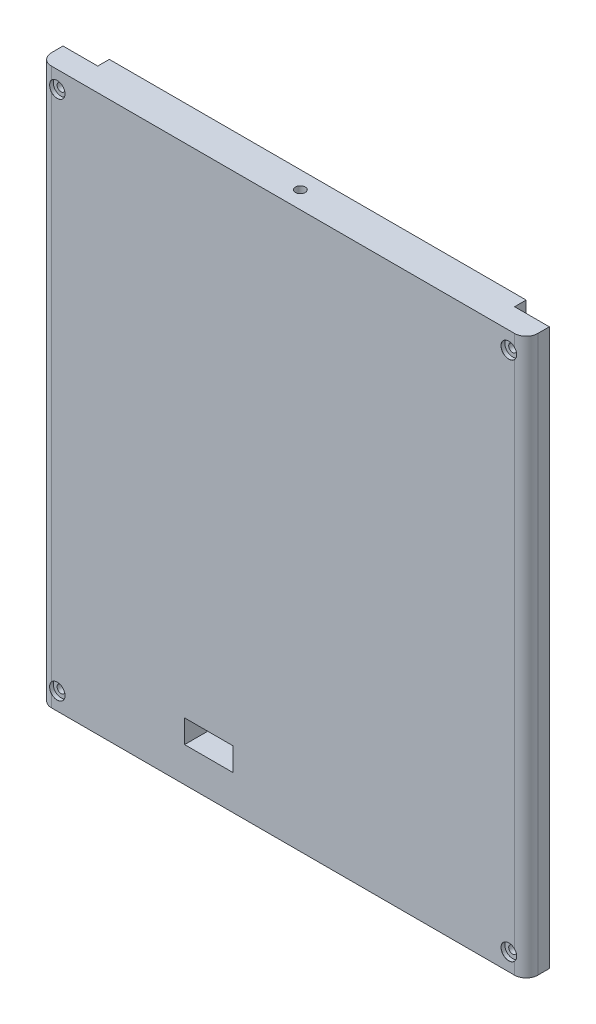
from build123d import *

# Parameters (mm, degrees)
SKETCH3_W           = 210
SKETCH3_H           = 10
BOSS_EXTRUDE1_DEPTH = 240
BOSS_EXTRUDE2_DEPTH = 205
SKETCH6_W           = 45
SKETCH6_H           = 15
BOSS_EXTRUDE3_DEPTH = 10
SKETCH7_R           = 1.65
CUT_EXTRUDE1_DEPTH  = 10
SKETCH8_W           = 21
SKETCH8_H           = 10
CUT_EXTRUDE2_DEPTH  = 10
SKETCH10_R          = 2.1
CUT_EXTRUDE3_DEPTH  = 4.5
FILLET2_R           = 5


with BuildPart() as part:
    # Sketch3 → Boss-Extrude1 (new body)
    with BuildSketch(Plane(origin=(0, 0, 0), x_dir=(1, 0, 0), z_dir=(0, 1, 0))):
        with Locations((0, -5)):
            Rectangle(SKETCH3_W, SKETCH3_H)
    extrude(amount=BOSS_EXTRUDE1_DEPTH)

    # Sketch5 → Boss-Extrude2 (add)
    with BuildSketch(Plane(origin=(0, 240, 0), x_dir=(1, 0, 0), z_dir=(0, 1, 0))):
        Polygon((-90, 0), (-90, 5), (90, 5), (90, 0), (105, 0), (105, -10), (-105, -10), (-105, 0), align=None)
    extrude(amount=-BOSS_EXTRUDE2_DEPTH)

    # Sketch6 → Boss-Extrude3 (add)
    with BuildSketch(Plane(origin=(0, 35, 0), x_dir=(1, 0, 0), z_dir=(0, 1, 0))):
        with Locations((0, 7.5)):
            Rectangle(SKETCH6_W, SKETCH6_H)
    extrude(amount=-BOSS_EXTRUDE3_DEPTH)

    # Sketch7 → Cut-Extrude1 (cut)
    with BuildSketch(Plane.XY.offset(10)):
        with Locations((-97.5, 232.5)):
            Circle(SKETCH7_R)
        with Locations((-97.5, 7.5)):
            Circle(SKETCH7_R)
        with Locations((97.5, 7.5)):
            Circle(SKETCH7_R)
        with Locations((97.5, 232.5)):
            Circle(SKETCH7_R)
    extrude(amount=-CUT_EXTRUDE1_DEPTH, mode=Mode.SUBTRACT)

    # Sketch8 → Cut-Extrude2 (cut)
    with BuildSketch(Plane.XY.offset(10)):
        with Locations((-32, 20)):
            Rectangle(SKETCH8_W, SKETCH8_H)
    extrude(amount=-CUT_EXTRUDE2_DEPTH, mode=Mode.SUBTRACT)

    # Sketch10 → Cut-Extrude3 (cut)
    with BuildSketch(Plane(origin=(0, 240, 0), x_dir=(1, 0, 0), z_dir=(0, 1, 0))):
        with Locations(Location((0, -2.5, 0), (0, 0, 270))):
            Circle(SKETCH10_R)
    extrude(amount=-CUT_EXTRUDE3_DEPTH, mode=Mode.SUBTRACT)

    # Sketch11 → CBORE for M3 SBHCS1 (revolve, cut)
    with BuildSketch(Plane(origin=(-97.5, 232.5, 10), x_dir=(0, -1, 0), z_dir=(1, 0, 0))):
        Polygon((0, 0), (0, 25), (1.7, 25), (1.7, 1.65), (3.35, 1.65), (3.35, 0.025), (3.375, 0), align=None)
    revolve(axis=Axis((-97.5, 232.5, 16.35), (0, 0, -1)), mode=Mode.SUBTRACT)

    # Sketch12 → CBORE for M3 SBHCS2 (revolve, cut)
    with BuildSketch(Plane(origin=(97.5, 232.5, 10), x_dir=(0, -1, 0), z_dir=(1, 0, 0))):
        Polygon((0, 0), (0, 25), (1.7, 25), (1.7, 1.65), (3.35, 1.65), (3.35, 0.025), (3.375, 0), align=None)
    revolve(axis=Axis((97.5, 232.5, 16.35), (0, 0, -1)), mode=Mode.SUBTRACT)

    # Sketch14 → CBORE for M3 SBHCS4 (revolve, cut)
    with BuildSketch(Plane(origin=(97.5, 7.5, 10), x_dir=(0, -1, 0), z_dir=(1, 0, 0))):
        Polygon((0, 0), (0, 25), (1.7, 25), (1.7, 1.65), (3.35, 1.65), (3.35, 0.025), (3.375, 0), align=None)
    revolve(axis=Axis((97.5, 7.5, 16.35), (0, 0, -1)), mode=Mode.SUBTRACT)

    # Sketch18 → CBORE for M3 SBHCS5 (revolve, cut)
    with BuildSketch(Plane(origin=(-97.5, 7.5, 10), x_dir=(0, -1, 0), z_dir=(1, 0, 0))):
        Polygon((0, 0), (0, 25), (1.7, 25), (1.7, 1.65), (3.35, 1.65), (3.35, 0.025), (3.375, 0), align=None)
    revolve(axis=Axis((-97.5, 7.5, 16.35), (0, 0, -1)), mode=Mode.SUBTRACT)

    # Fillet2
    # the kernel refuses this fillet: 5 mm, written as the material it takes off along each edge
    with BuildSketch(Plane(origin=(105, 252.5, 10), x_dir=(0, 0, -1), z_dir=(0, -1, 0)), Plane(origin=(-105, -12.5, 10), x_dir=(0, 0, -1), z_dir=(0, 1, 0))) as fillet2_piece_1:
        with BuildLine():
            CenterArc((FILLET2_R, -FILLET2_R), FILLET2_R, 90, 90)
            Line((0, -FILLET2_R), (0, 0))
            Line((0, 0), (FILLET2_R, 0))
        make_face()
    extrude(amount=265, mode=Mode.SUBTRACT)


solid = part.part
